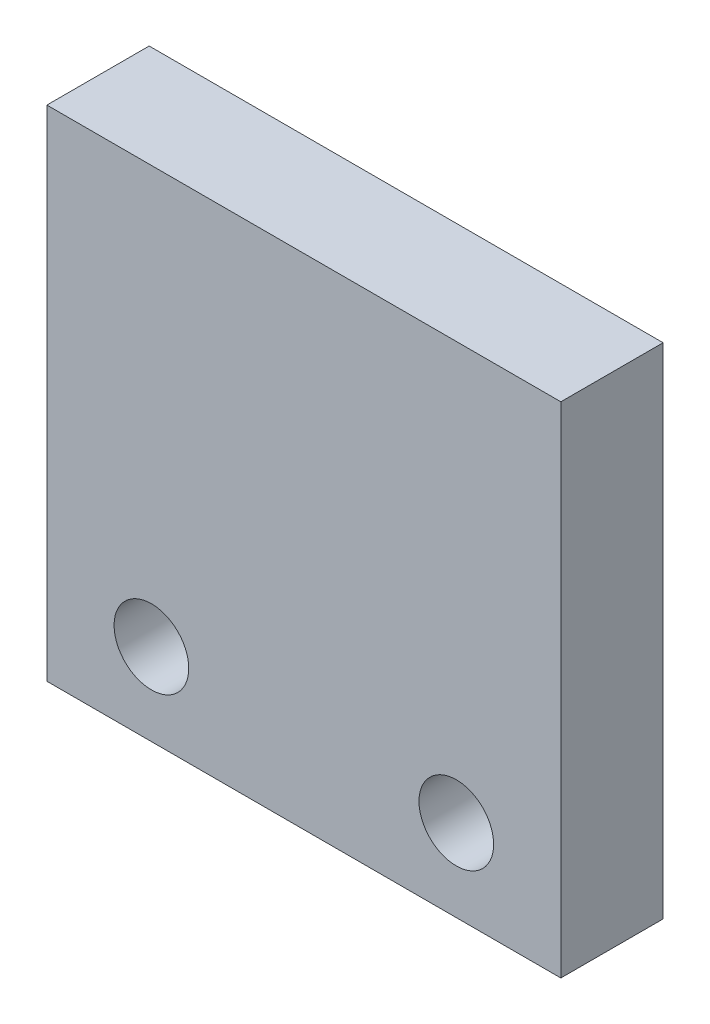
from build123d import *

# Parameters (mm, degrees)
SKETCH1_W           = 34.42
SKETCH1_H           = 33.42
SKETCH1_R           = 2.5
BOSS_EXTRUDE1_DEPTH = 6.85


with BuildPart() as part:
    # Sketch1 → Boss-Extrude1 (new body)
    with BuildSketch(Plane.XY):
        Rectangle(SKETCH1_W, SKETCH1_H)
        with Locations((10.21, -11.21)):
            Circle(SKETCH1_R, mode=Mode.SUBTRACT)
        with Locations((-10.21, -11.21)):
            Circle(SKETCH1_R, mode=Mode.SUBTRACT)
    extrude(amount=BOSS_EXTRUDE1_DEPTH)


solid = part.part
